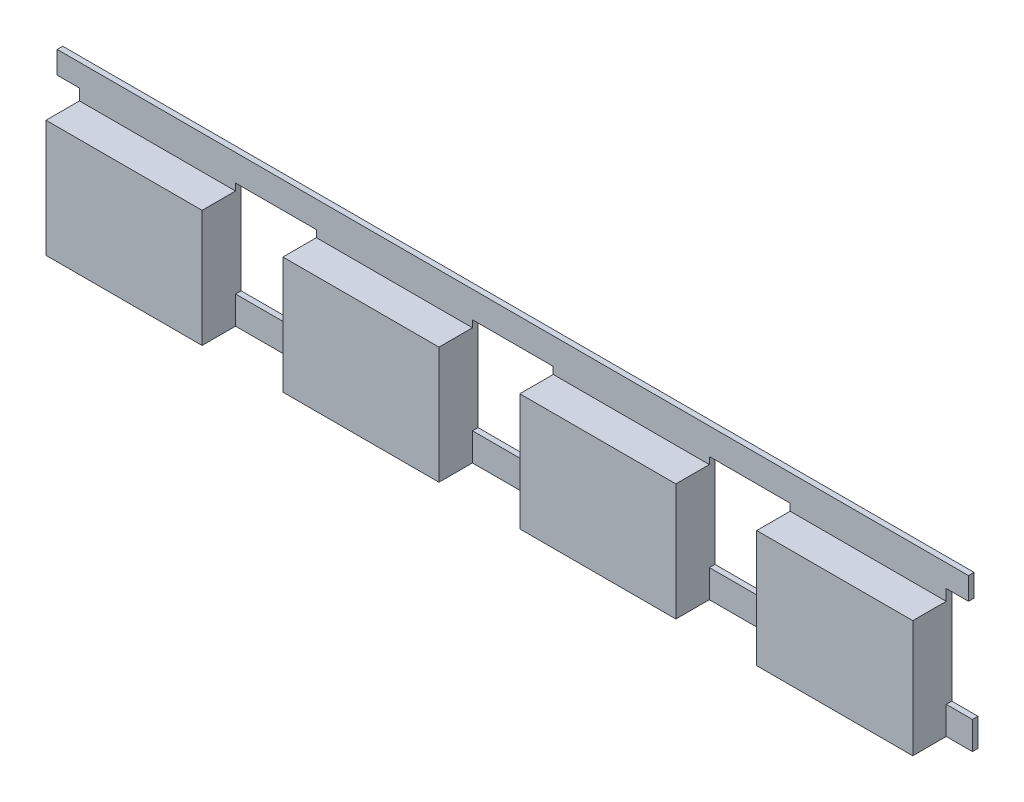
from build123d import *

# Parameters (mm, degrees)
SKETCH_1_W             = 5.6
SKETCH_1_H             = 4.2
EXTRUDE_1_DEPTH        = 1.4
SKETCH_3_W             = 31.1
SKETCH_3_H             = 1.5
EXTRUDE_2_DEPTH        = 0.2
PATTERN_LINEAR_1_COUNT = 4
PATTERN_LINEAR_1_PITCH = 8.5
SKETCH_4_W             = 2.9
SKETCH_4_H             = 1.1
CUT_EXTRUDE_1_DEPTH    = 0.2
SKETCH_5_W             = 0.2
SKETCH_5_H             = 0.8
EXTRUDE_3_DEPTH        = 0.8
SKETCH_6_W             = 0.2
SKETCH_6_H             = 0.8
EXTRUDE_4_DEPTH        = 0.8
SKETCH_7_W             = 32.884134448
SKETCH_7_H             = 1
EXTRUDE_5_DEPTH        = 0.2
CUT_EXTRUDE_START      = -0.4
SKETCH_8_W             = 4.4
SKETCH_8_H             = 3
CUT_EXTRUDE_2_DEPTH    = 1


with BuildPart() as part:
    # Эскиз1 → Бобышка-Вытянуть1 (new body)
    with BuildSketch(Plane.XY):
        Rectangle(SKETCH_1_W, SKETCH_1_H)
    extrude_1 = extrude(amount=EXTRUDE_1_DEPTH)

    # Эскиз3 → Бобышка-Вытянуть2 (add)
    with BuildSketch(Plane(origin=(0, 0, 0), x_dir=(-1, 0, 0), z_dir=(0, 0, -1))):
        with Locations((-12.75, 2.55)):
            Rectangle(SKETCH_3_W, SKETCH_3_H)
    extrude(amount=-EXTRUDE_2_DEPTH)

    # Линейный массив1: Бобышка-Вытянуть1 ×4
    with Locations(*[(i * PATTERN_LINEAR_1_PITCH, 0, 0) for i in range(1, PATTERN_LINEAR_1_COUNT)]):
        add(extrude_1)

    # Эскиз4 → Вырез-Вытянуть1 (cut)
    with BuildSketch(Plane(origin=(0, 0, 0), x_dir=(-1, 0, 0), z_dir=(0, 0, -1))):
        with Locations((-21.25, 1.8)):
            Rectangle(SKETCH_4_W, SKETCH_4_H)
        with Locations((-12.75, 1.8)):
            Rectangle(SKETCH_4_W, SKETCH_4_H)
        with Locations((-4.25, 1.8)):
            Rectangle(SKETCH_4_W, SKETCH_4_H)
    extrude(amount=-CUT_EXTRUDE_1_DEPTH, mode=Mode.SUBTRACT)

    # Эскиз5 → Бобышка-Вытянуть3 (add)
    with BuildSketch(Plane(origin=(28.3, 0, 0), x_dir=(0, 0, -1), z_dir=(1, 0, 0))):
        with Locations((-0.1, 2.9)):
            Rectangle(SKETCH_5_W, SKETCH_5_H)
    extrude(amount=EXTRUDE_3_DEPTH)

    # Эскиз6 → Бобышка-Вытянуть4 (add)
    with BuildSketch(Plane.ZY.offset(2.8)):
        with Locations((0.1, 2.9)):
            Rectangle(SKETCH_6_W, SKETCH_6_H)
    extrude(amount=EXTRUDE_4_DEPTH)

    # Эскиз7 → Бобышка-Вытянуть5 (add)
    with BuildSketch(Plane(origin=(0, 0, 0), x_dir=(-1, 0, 0), z_dir=(0, 0, -1))):
        with Locations((-12.798406479, -1.6)):
            Rectangle(SKETCH_7_W, SKETCH_7_H)
    extrude(amount=-EXTRUDE_5_DEPTH)

    # Эскиз8 → Вырез-Вытянуть2 (cut)
    with BuildSketch(Plane.XY.offset(1.4).offset(CUT_EXTRUDE_START)):
        Rectangle(SKETCH_8_W, SKETCH_8_H)
        with Locations((8.5, 0)):
            Rectangle(SKETCH_8_W, SKETCH_8_H)
        with Locations((17, 0)):
            Rectangle(SKETCH_8_W, SKETCH_8_H)
        with Locations((25.5, 0)):
            Rectangle(SKETCH_8_W, SKETCH_8_H)
    extrude(amount=-CUT_EXTRUDE_2_DEPTH, mode=Mode.SUBTRACT)


solid = part.part
